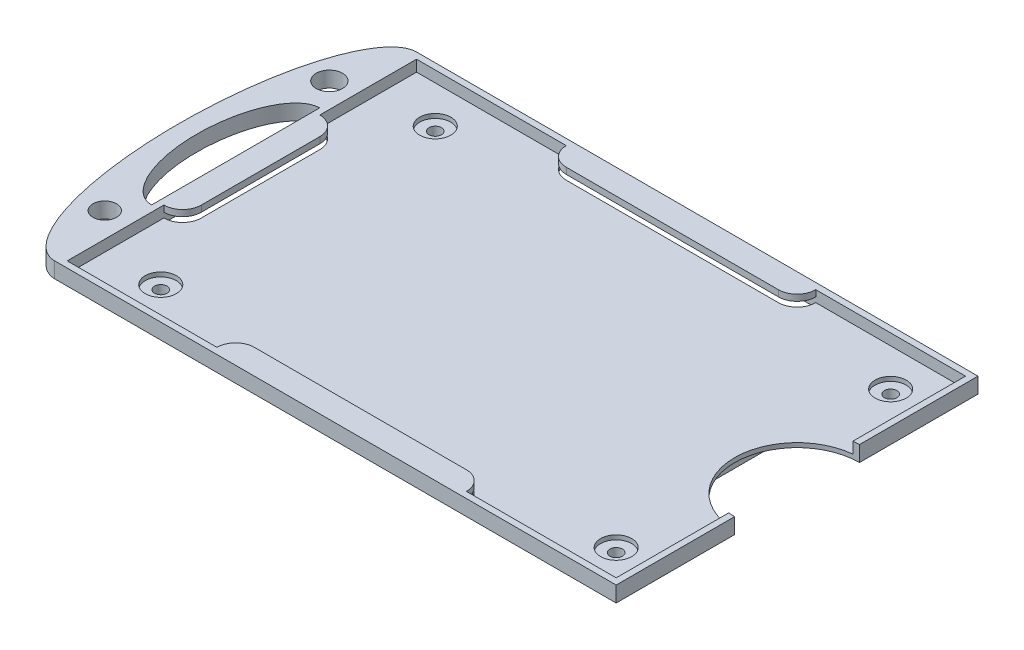
from build123d import *

# Parameters (mm, degrees)
IZIM1_W                     = 90
IZIM1_H                     = 58
Y_KSEKLIK_EKSTR_ZYON1_DEPTH = 2.5
IZIM3_R                     = 10
KES_EKSTR_ZYON2_DEPTH       = 30.7
IZIM16_W                    = 88
IZIM16_H                    = 56
KES_EKSTR_ZYON9_DEPTH       = 1.8
IZIM4_W                     = 40
IZIM4_H                     = 4
IZIM4_W_2                   = 4
IZIM4_H_2                   = 25
Y_KSEKLIK_EKSTR_ZYON2_DEPTH = 1
RADYUS1_R                   = 3
KES_EKSTR_ZYON3_DEPTH       = 31
Y_KSEKLIK_EKSTR_ZYON5_DEPTH = 3.8
IZIM7_R                     = 0.75
Y_KSEKLIK_EKSTR_ZYON4_DEPTH = 3
Y_KSEKLIK_EKSTR_ZYON6_START = -2.5
IZIM12_R                    = 1.893198604
IZIM12_R_2                  = 2.118418654
Y_KSEKLIK_EKSTR_ZYON6_DEPTH = 2.5
IZIM13_R                    = 4
IZIM13_R_2                  = 1
Y_KSEKLIK_EKSTR_ZYON7_DEPTH = 2
IZIM14_R                    = 2.5
KES_EKSTR_ZYON5_DEPTH       = 1


with BuildPart() as part:
    # Çizim1 → Yükseklik-Ekstrüzyon1 (new body)
    with BuildSketch(Plane(origin=(0, 0, 0), x_dir=(1, 0, 0), z_dir=(0, 1, 0))):
        with Locations((-1.116392696, -13.102112676)):
            Rectangle(IZIM1_W, IZIM1_H)
    extrude(amount=Y_KSEKLIK_EKSTR_ZYON1_DEPTH)

    # Çizim3 → Kes-Ekstrüzyon2 (cut)
    with BuildSketch(Plane(origin=(0, 2.5, 0), x_dir=(1, 0, 0), z_dir=(0, 1, 0))):
        with Locations((43.883607304, -13.102112676)):
            Circle(IZIM3_R)
    extrude(amount=-KES_EKSTR_ZYON2_DEPTH, mode=Mode.SUBTRACT)

    # Çizim16 → Kes-Ekstrüzyon9 (cut)
    with BuildSketch(Plane(origin=(0, 2.5, 0), x_dir=(1, 0, 0), z_dir=(0, 1, 0))):
        with Locations((-1.116392696, -13.102112676)):
            Rectangle(IZIM16_W, IZIM16_H)
    extrude(amount=-KES_EKSTR_ZYON9_DEPTH, mode=Mode.SUBTRACT)

    # Çizim4 → Yükseklik-Ekstrüzyon2 (add)
    with BuildSketch(Plane(origin=(0, 2.5, 0), x_dir=(1, 0, 0), z_dir=(0, 1, 0))):
        with Locations((-1.116392696, 13.897887324)):
            Rectangle(IZIM4_W, IZIM4_H)
        with Locations((-1.116392696, -40.102112676)):
            Rectangle(IZIM4_W, IZIM4_H)
        with Locations((-44.116392696, -13.102112676)):
            Rectangle(IZIM4_W_2, IZIM4_H_2)
    extrude(amount=-Y_KSEKLIK_EKSTR_ZYON2_DEPTH)

    # Radyus1
    radyus1_edges = [part.edges().sort_by_distance(p)[0] for p in [
        (18.883607304, 2, -11.897887324),
        (-21.116392696, 2, -11.897887324),
        (-21.116392696, 2, 38.102112676),
        (18.883607304, 2, 38.102112676),
        (-42.116392696, 2, 25.602112676),
        (-42.116392696, 2, 0.602112676),
    ]]
    fillet(radyus1_edges, radius=RADYUS1_R - 0.0001)  # a hair under: the kernel refuses the full size

    # Çizim5 → Kes-Ekstrüzyon3 (cut)
    with BuildSketch(Plane(origin=(0, 1.5, 0), x_dir=(-1, 0, 0), z_dir=(0, -1, 0))):
        with BuildLine():
            Line((21.116392696, 14.897887324), (-18.883607304, 14.897887324))
            ThreePointArc((-18.883607304, 14.897887324), (-18.004927647, 12.77656698), (-15.883607304, 11.897887324))
            Line((-15.883607304, 11.897887324), (18.116392696, 11.897887324))
            ThreePointArc((18.116392696, 11.897887324), (20.23771304, 12.77656698), (21.116392696, 14.897887324))
        make_face()
        with BuildLine():
            Line((-18.883607304, -41.102112676), (21.116392696, -41.102112676))
            ThreePointArc((21.116392696, -41.102112676), (20.23771304, -38.980792332), (18.116392696, -38.102112676))
            Line((18.116392696, -38.102112676), (-15.883607304, -38.102112676))
            ThreePointArc((-15.883607304, -38.102112676), (-18.004927647, -38.980792332), (-18.883607304, -41.102112676))
        make_face()
        with BuildLine():
            Line((42.116392696, -3.602112676), (42.116392696, -22.602112676))
            ThreePointArc((42.116392696, -22.602112676), (42.995072353, -24.72343302), (45.116392696, -25.602112676))
            Line((45.116392696, -25.602112676), (45.116392696, -0.602112676))
            ThreePointArc((45.116392696, -0.602112676), (42.995072353, -1.480792332), (42.116392696, -3.602112676))
        make_face()
    extrude(amount=KES_EKSTR_ZYON3_DEPTH, mode=Mode.SUBTRACT)

    # Çizim8 → Yükseklik-Ekstrüzyon5 (add)
    with BuildSketch(Plane.XZ):
        with BuildLine():
            ThreePointArc((30.883607304, 33.102112676), (30.004927647, 35.22343302), (27.883607304, 36.102112676))
            Line((27.883607304, 36.102112676), (-27.116392696, 36.102112676))
            ThreePointArc((-27.116392696, 36.102112676), (-29.23771304, 35.22343302), (-30.116392696, 33.102112676))
            Line((-30.116392696, 33.102112676), (-30.116392696, -6.897887324))
            ThreePointArc((-30.116392696, -6.897887324), (-29.23771304, -9.019207668), (-27.116392696, -9.897887324))
            Line((-27.116392696, -9.897887324), (27.883607304, -9.897887324))
            ThreePointArc((27.883607304, -9.897887324), (30.004927647, -9.019207668), (30.883607304, -6.897887324))
            Line((30.883607304, -6.897887324), (30.883607304, 33.102112676))
        make_face()
        with BuildLine():
            Line((-25.116392696, 34.102112676), (-17.877937152, 34.102112676))
            Line((-17.877937152, 34.102112676), (14.321922447, 34.102112676))
            Line((14.321922447, 34.102112676), (25.883607304, 34.102112676))
            ThreePointArc((25.883607304, 34.102112676), (28.004927647, 33.22343302), (28.883607304, 31.102112676))
            Line((28.883607304, 31.102112676), (28.883607304, -4.897887324))
            ThreePointArc((28.883607304, -4.897887324), (28.004927647, -7.019207668), (25.883607304, -7.897887324))
            Line((25.883607304, -7.897887324), (14.383607304, -7.897887324))
            Line((14.383607304, -7.897887324), (-17.616392696, -7.897887324))
            Line((-17.616392696, -7.897887324), (-25.116392696, -7.897887324))
            ThreePointArc((-25.116392696, -7.897887324), (-27.23771304, -7.019207668), (-28.116392696, -4.897887324))
            Line((-28.116392696, -4.897887324), (-28.116392696, 4.369696826))
            Line((-28.116392696, 4.369696826), (-28.116392696, 21.402895856))
            Line((-28.116392696, 21.402895856), (-28.116392696, 31.102112676))
            ThreePointArc((-28.116392696, 31.102112676), (-27.23771304, 33.22343302), (-25.116392696, 34.102112676))
        make_face(mode=Mode.SUBTRACT)
    extrude(amount=Y_KSEKLIK_EKSTR_ZYON5_DEPTH)

    # Çizim7 → Yükseklik-Ekstrüzyon4 (add)
    with BuildSketch(Plane.XZ):
        with Locations(Location((-7.968182689, 1.248999423, 0), (0, 0, 270))):
            Circle(IZIM7_R)
        with Locations(Location((-8.918182689, 24.543381185, 0), (0, 0, 270))):
            Circle(IZIM7_R)
    extrude(amount=Y_KSEKLIK_EKSTR_ZYON4_DEPTH)

    # Çizim12 → Yükseklik-Ekstrüzyon6 (add)
    with BuildSketch(Plane(origin=(0, 2.5, 0), x_dir=(1, 0, 0), z_dir=(0, 1, 0)).offset(Y_KSEKLIK_EKSTR_ZYON6_START)):
        with BuildLine():
            add(Edge.make_bspline(
                [(-46.116392696, 15.897887324), (-55.226210412, 15.897887324), (-55.226210412, -13.102112676), (-55.226210412, -42.102112676), (-46.116392696, -42.102112676)],
                knots=[0, 0, 0, 1.570796327, 1.570796327, 3.141592654, 3.141592654, 3.141592654], degree=2, weights=[1, 0.707106781, 1, 0.707106781, 1]))
            Line((-46.116392696, -42.102112676), (-46.116392696, -26.566258419))
            add(Edge.make_bspline(
                [(-46.116392696, 0.362033067), (-52.331277279, 0.362033067), (-52.331277279, -13.102112676), (-52.331277279, -26.566258419), (-46.116392696, -26.566258419)],
                knots=[0, 0, 0, 1.570796327, 1.570796327, 3.141592654, 3.141592654, 3.141592654], degree=2, weights=[1, 0.707106781, 1, 0.707106781, 1]))
            Line((-46.116392696, 0.362033067), (-46.116392696, 15.897887324))
        make_face()
        with Locations(Location((-49.092177599, -31.102112676, 0), (0, 0, 270))):
            Circle(IZIM12_R, mode=Mode.SUBTRACT)
        with Locations(Location((-49.092177599, 4.897887324, 0), (0, 0, 270))):
            Circle(IZIM12_R_2, mode=Mode.SUBTRACT)
    extrude(amount=Y_KSEKLIK_EKSTR_ZYON6_DEPTH)

    # Çizim13 → Yükseklik-Ekstrüzyon7 (add)
    # profile 1 of 4: a face of its own
    with BuildSketch(Plane(origin=(0, 0, 0), x_dir=(-1, 0, 0), z_dir=(0, -1, 0))):
        with Locations(Location((36.116392696, -35.102112676, 0), (0, 0, 90))):
            Circle(IZIM13_R)
        with Locations(Location((36.116392696, -35.102112676, 0), (0, 0, 90))):
            Circle(IZIM13_R_2, mode=Mode.SUBTRACT)
    # profile 2 of 4: a face of its own
    with BuildSketch(Plane(origin=(0, 0, 0), x_dir=(-1, 0, 0), z_dir=(0, -1, 0))):
        with Locations(Location((36.116392696, 8.897887324, 0), (0, 0, 90))):
            Circle(IZIM13_R)
        with Locations(Location((36.116392696, 8.897887324, 0), (0, 0, 90))):
            Circle(IZIM13_R_2, mode=Mode.SUBTRACT)
    # profile 3 of 4: a face of its own
    with BuildSketch(Plane(origin=(0, 0, 0), x_dir=(-1, 0, 0), z_dir=(0, -1, 0))):
        with Locations(Location((-36.883607304, 8.897887324, 0), (0, 0, 90))):
            Circle(IZIM13_R)
        with Locations(Location((-36.883607304, 8.897887324, 0), (0, 0, 90))):
            Circle(IZIM13_R_2, mode=Mode.SUBTRACT)
    # profile 4 of 4: a face of its own
    with BuildSketch(Plane(origin=(0, 0, 0), x_dir=(-1, 0, 0), z_dir=(0, -1, 0))):
        with Locations(Location((-36.883607304, -35.102112676, 0), (0, 0, 90))):
            Circle(IZIM13_R)
        with Locations(Location((-36.883607304, -35.102112676, 0), (0, 0, 90))):
            Circle(IZIM13_R_2, mode=Mode.SUBTRACT)
    extrude(amount=Y_KSEKLIK_EKSTR_ZYON7_DEPTH)

    # Çizim14 → Kes-Ekstrüzyon5 (cut)
    with BuildSketch(Plane(origin=(0, 1, 0), x_dir=(1, 0, 0), z_dir=(0, 1, 0))):
        with Locations(Location((-36.116392696, -35.102112676, 0), (0, 0, 270))):
            Circle(IZIM14_R)
        with Locations(Location((-36.116392696, 8.897887324, 0), (0, 0, 270))):
            Circle(IZIM14_R)
        with Locations(Location((36.883607304, -35.102112676, 0), (0, 0, 270))):
            Circle(IZIM14_R)
        with Locations(Location((36.883607304, 8.897887324, 0), (0, 0, 270))):
            Circle(IZIM14_R)
    extrude(amount=-KES_EKSTR_ZYON5_DEPTH, mode=Mode.SUBTRACT)


solid = part.part
